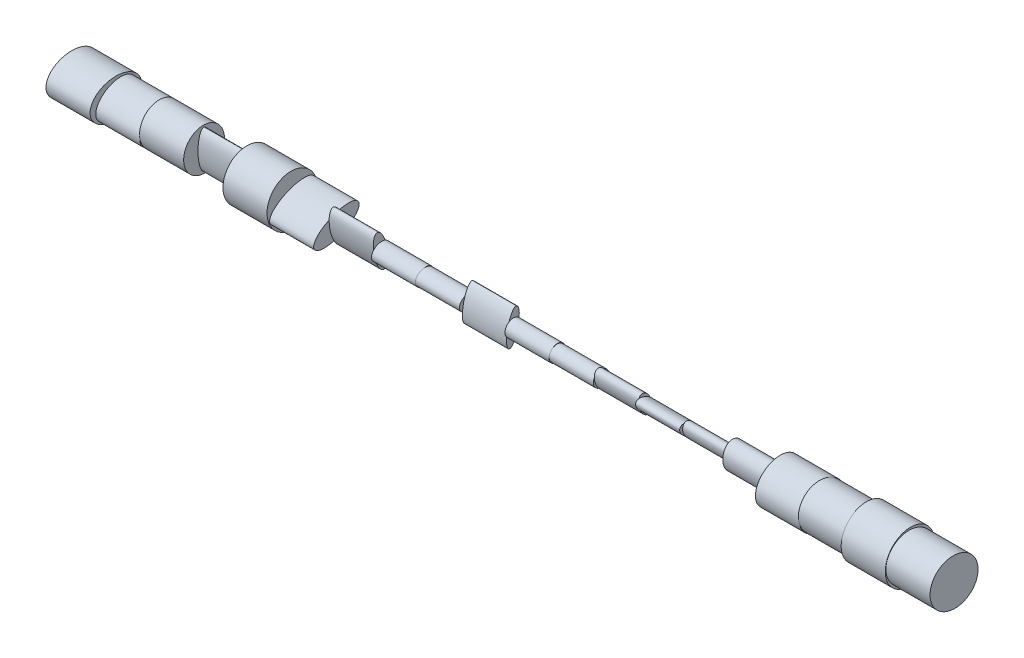
from build123d import *

# Parameters (mm, degrees)
SKETCH1_RX           = 5.82759509
SKETCH1_RY           = 4.321195457
BOSS_EXTRUDE1_DEPTH  = 10
SKETCH2_RX           = 4.75538813
SKETCH2_RY           = 3.393373988
BOSS_EXTRUDE2_DEPTH  = 10
SKETCH3_RX           = 4.809033971
SKETCH3_RY           = 4.582240871
BOSS_EXTRUDE3_DEPTH  = 10
SKETCH4_RX           = 4.328871226
SKETCH4_RY           = 1.372408016
BOSS_EXTRUDE4_DEPTH  = 10
SKETCH5_RX           = 5.910879564
SKETCH5_RY           = 5.612765057
BOSS_EXTRUDE5_DEPTH  = 10
SKETCH6_RX           = 5.476283411
SKETCH6_RY           = 2.437817542
BOSS_EXTRUDE6_DEPTH  = 10
SKETCH7_RX           = 4.05492815
SKETCH7_RY           = 1.445563253
BOSS_EXTRUDE7_DEPTH  = 10
SKETCH8_RX           = 2.089987051
SKETCH8_RY           = 1.709729716
BOSS_EXTRUDE8_DEPTH  = 10
SKETCH9_RX           = 2.097435201
SKETCH9_RY           = 1.726739344
BOSS_EXTRUDE9_DEPTH  = 10
SKETCH10_RX          = 3.909149538
SKETCH10_RY          = 1.240948345
BOSS_EXTRUDE10_DEPTH = 10
SKETCH11_RX          = 1.86622268
SKETCH11_RY          = 1.725348435
BOSS_EXTRUDE11_DEPTH = 10
SKETCH12_RX          = 1.769540019
SKETCH12_RY          = 1.724622348
BOSS_EXTRUDE12_DEPTH = 10
SKETCH13_RX          = 2.463568239
SKETCH13_RY          = 1.351542022
BOSS_EXTRUDE13_DEPTH = 10
SKETCH14_RX          = 2.498896391
SKETCH14_RY          = 1.275632328
BOSS_EXTRUDE14_DEPTH = 10
SKETCH15_RX          = 2.105341136
SKETCH15_RY          = 1.272395382
BOSS_EXTRUDE15_DEPTH = 10
SKETCH16_RX          = 3.184076347
SKETCH16_RY          = 2.394019003
BOSS_EXTRUDE16_DEPTH = 10
SKETCH17_RX          = 5.160032141
SKETCH17_RY          = 4.451075131
BOSS_EXTRUDE17_DEPTH = 10
SKETCH18_RX          = 5.470347182
SKETCH18_RY          = 5.003258014
BOSS_EXTRUDE18_DEPTH = 10
SKETCH19_RX          = 5.756295646
SKETCH19_RY          = 5.547149234
BOSS_EXTRUDE19_DEPTH = 10
SKETCH20_RX          = 5.483461838
SKETCH20_RY          = 5.218587665
BOSS_EXTRUDE20_DEPTH = 10


with BuildPart() as part:
    # Sketch1 → Boss-Extrude1 (new body)
    with BuildSketch(Plane(origin=(0, 0, 0), x_dir=(0, 0, -1), z_dir=(1, 0, 0))):
        with Locations(Location((0, 0), (0, 0, 180))):
            Ellipse(SKETCH1_RX, SKETCH1_RY)
    extrude(amount=BOSS_EXTRUDE1_DEPTH)

    # Sketch2 → Boss-Extrude2 (add)
    with BuildSketch(Plane(origin=(10, 0, 0), x_dir=(0, 0, -1), z_dir=(1, 0, 0))):
        with Locations(Location((0, 0), (0, 0, 24.395384448))):
            Ellipse(SKETCH2_RX, SKETCH2_RY)
    extrude(amount=BOSS_EXTRUDE2_DEPTH)

    # Sketch3 → Boss-Extrude3 (add)
    with BuildSketch(Plane(origin=(20, 0, 0), x_dir=(0, 0, -1), z_dir=(1, 0, 0))):
        with Locations(Location((0, 0), (0, 0, 115.188401627))):
            Ellipse(SKETCH3_RX, SKETCH3_RY)
    extrude(amount=BOSS_EXTRUDE3_DEPTH)

    # Sketch4 → Boss-Extrude4 (add)
    with BuildSketch(Plane(origin=(30, 0, 0), x_dir=(0, 0, -1), z_dir=(1, 0, 0))):
        with Locations(Location((0, 0), (0, 0, -88.793454923))):
            Ellipse(SKETCH4_RX, SKETCH4_RY)
    extrude(amount=BOSS_EXTRUDE4_DEPTH)

    # Sketch5 → Boss-Extrude5 (add)
    with BuildSketch(Plane(origin=(40, 0, 0), x_dir=(0, 0, -1), z_dir=(1, 0, 0))):
        with Locations(Location((0, 0), (0, 0, 126.324138229))):
            Ellipse(SKETCH5_RX, SKETCH5_RY)
    extrude(amount=BOSS_EXTRUDE5_DEPTH)

    # Sketch6 → Boss-Extrude6 (add)
    with BuildSketch(Plane(origin=(50, 0, 0), x_dir=(0, 0, -1), z_dir=(1, 0, 0))):
        with Locations(Location((0, 0), (0, 0, -158.092328999))):
            Ellipse(SKETCH6_RX, SKETCH6_RY)
    extrude(amount=BOSS_EXTRUDE6_DEPTH)

    # Sketch7 → Boss-Extrude7 (add)
    with BuildSketch(Plane(origin=(60, 0, 0), x_dir=(0, 0, -1), z_dir=(1, 0, 0))):
        with Locations(Location((0, 0), (0, 0, -77.930672412))):
            Ellipse(SKETCH7_RX, SKETCH7_RY)
    extrude(amount=BOSS_EXTRUDE7_DEPTH)

    # Sketch8 → Boss-Extrude8 (add)
    with BuildSketch(Plane(origin=(70, 0, 0), x_dir=(0, 0, -1), z_dir=(1, 0, 0))):
        with Locations(Location((0, 0), (0, 0, -158.792571692))):
            Ellipse(SKETCH8_RX, SKETCH8_RY)
    extrude(amount=BOSS_EXTRUDE8_DEPTH)

    # Sketch9 → Boss-Extrude9 (add)
    with BuildSketch(Plane(origin=(80, 0, 0), x_dir=(0, 0, -1), z_dir=(1, 0, 0))):
        with Locations(Location((0, 0), (0, 0, 5.892812627))):
            Ellipse(SKETCH9_RX, SKETCH9_RY)
    extrude(amount=BOSS_EXTRUDE9_DEPTH)

    # Sketch10 → Boss-Extrude10 (add)
    with BuildSketch(Plane(origin=(90, 0, 0), x_dir=(0, 0, -1), z_dir=(1, 0, 0))):
        with Locations(Location((0, 0), (0, 0, -101.779809201))):
            Ellipse(SKETCH10_RX, SKETCH10_RY)
    extrude(amount=BOSS_EXTRUDE10_DEPTH)

    # Sketch11 → Boss-Extrude11 (add)
    with BuildSketch(Plane(origin=(100, 0, 0), x_dir=(0, 0, -1), z_dir=(1, 0, 0))):
        with Locations(Location((0, 0), (0, 0, -132.061931796))):
            Ellipse(SKETCH11_RX, SKETCH11_RY)
    extrude(amount=BOSS_EXTRUDE11_DEPTH)

    # Sketch12 → Boss-Extrude12 (add)
    with BuildSketch(Plane(origin=(110, 0, 0), x_dir=(0, 0, -1), z_dir=(1, 0, 0))):
        with Locations(Location((0, 0), (0, 0, 15.190802526))):
            Ellipse(SKETCH12_RX, SKETCH12_RY)
    extrude(amount=BOSS_EXTRUDE12_DEPTH)

    # Sketch13 → Boss-Extrude13 (add)
    with BuildSketch(Plane(origin=(120, 0, 0), x_dir=(0, 0, -1), z_dir=(1, 0, 0))):
        with Locations(Location((0, 0), (0, 0, 111.509692034))):
            Ellipse(SKETCH13_RX, SKETCH13_RY)
    extrude(amount=BOSS_EXTRUDE13_DEPTH)

    # Sketch14 → Boss-Extrude14 (add)
    with BuildSketch(Plane(origin=(130, 0, 0), x_dir=(0, 0, -1), z_dir=(1, 0, 0))):
        with Locations(Location((0, 0), (0, 0, 146.492749268))):
            Ellipse(SKETCH14_RX, SKETCH14_RY)
    extrude(amount=BOSS_EXTRUDE14_DEPTH)

    # Sketch15 → Boss-Extrude15 (add)
    with BuildSketch(Plane(origin=(140, 0, 0), x_dir=(0, 0, -1), z_dir=(1, 0, 0))):
        with Locations(Location((0, 0), (0, 0, -60.039767696))):
            Ellipse(SKETCH15_RX, SKETCH15_RY)
    extrude(amount=BOSS_EXTRUDE15_DEPTH)

    # Sketch16 → Boss-Extrude16 (add)
    with BuildSketch(Plane(origin=(150, 0, 0), x_dir=(0, 0, -1), z_dir=(1, 0, 0))):
        with Locations(Location((0, 0), (0, 0, -80.933220227))):
            Ellipse(SKETCH16_RX, SKETCH16_RY)
    extrude(amount=BOSS_EXTRUDE16_DEPTH)

    # Sketch17 → Boss-Extrude17 (add)
    with BuildSketch(Plane(origin=(160, 0, 0), x_dir=(0, 0, -1), z_dir=(1, 0, 0))):
        with Locations(Location((0, 0), (0, 0, 27.658276407))):
            Ellipse(SKETCH17_RX, SKETCH17_RY)
    extrude(amount=BOSS_EXTRUDE17_DEPTH)

    # Sketch18 → Boss-Extrude18 (add)
    with BuildSketch(Plane(origin=(170, 0, 0), x_dir=(0, 0, -1), z_dir=(1, 0, 0))):
        with Locations(Location((0, 0), (0, 0, -40.097938154))):
            Ellipse(SKETCH18_RX, SKETCH18_RY)
    extrude(amount=BOSS_EXTRUDE18_DEPTH)

    # Sketch19 → Boss-Extrude19 (add)
    with BuildSketch(Plane(origin=(180, 0, 0), x_dir=(0, 0, -1), z_dir=(1, 0, 0))):
        with Locations(Location((0, 0), (0, 0, 64.551173128))):
            Ellipse(SKETCH19_RX, SKETCH19_RY)
    extrude(amount=BOSS_EXTRUDE19_DEPTH)

    # Sketch20 → Boss-Extrude20 (add)
    with BuildSketch(Plane(origin=(190, 0, 0), x_dir=(0, 0, -1), z_dir=(1, 0, 0))):
        with Locations(Location((0, 0), (0, 0, 155.943502478))):
            Ellipse(SKETCH20_RX, SKETCH20_RY)
    extrude(amount=BOSS_EXTRUDE20_DEPTH)


solid = part.part
